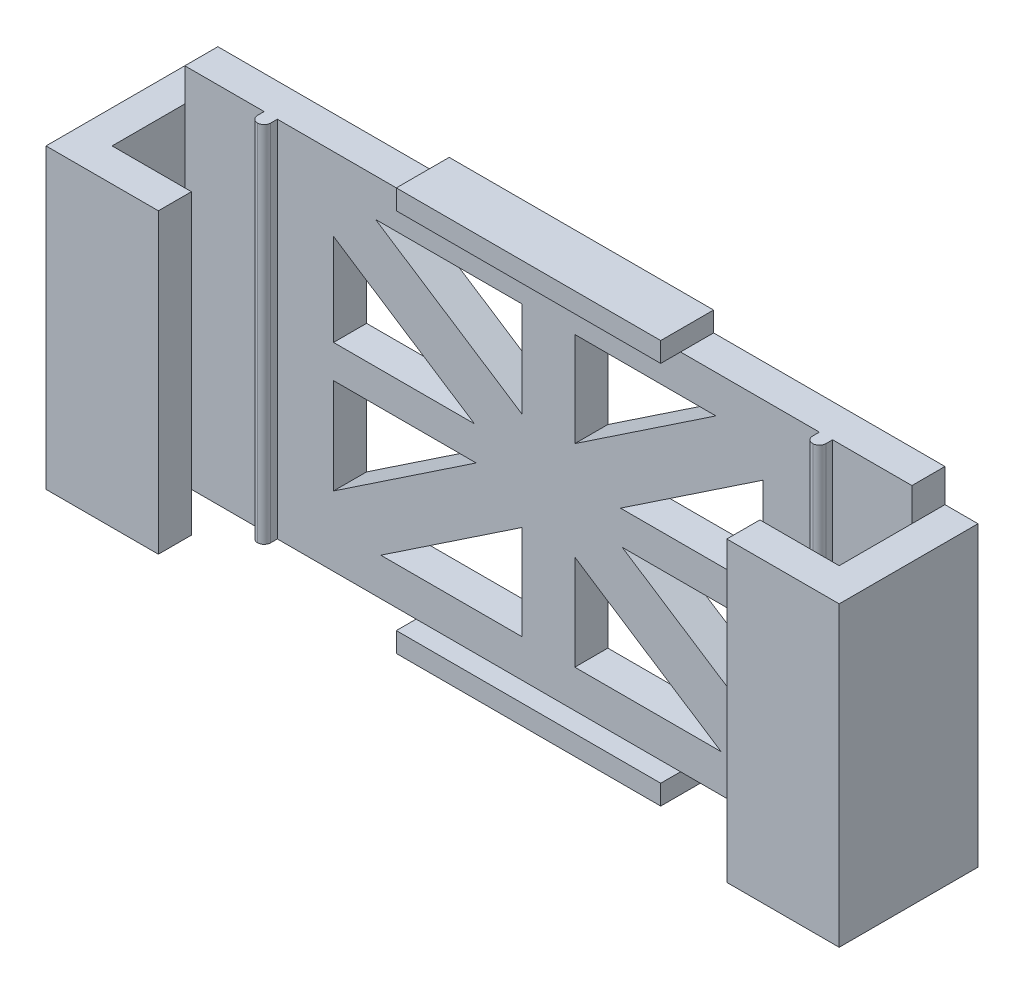
from build123d import *

# Parameters (mm, degrees)
SKETCH1_W             = 82
SKETCH1_H             = 55
BOSS_EXTRUDE1_DEPTH   = 5
SKETCH1_W_2           = 12
BOSS_EXTRUDE1_2_DEPTH = 5
BOSS_EXTRUDE1_3_DEPTH = 5
SKETCH1_3_W           = 2
SKETCH1_3_H           = 55
BOSS_EXTRUDE2_DEPTH   = 7
FILLET1_R             = 1
SKETCH2_W             = 5
SKETCH2_H             = 45
BOSS_EXTRUDE3_DEPTH   = 16
SKETCH3_W             = 17
SKETCH3_H             = 45
BOSS_EXTRUDE4_DEPTH   = 5
SKETCH4_W             = 40
SKETCH4_H             = 3
BOSS_EXTRUDE5_DEPTH   = 8
CUT_EXTRUDE1_DEPTH    = 8


with BuildPart() as part:
    # Sketch1 → Boss-Extrude1 (new body)
    with BuildSketch(Plane.XY):
        Rectangle(SKETCH1_W, SKETCH1_H)
    extrude(amount=BOSS_EXTRUDE1_DEPTH)



with BuildPart() as body_2:
    # Sketch1 → Boss-Extrude1 2 (new body)
    with BuildSketch(Plane.XY):
        with Locations((-49, 0)):
            Rectangle(SKETCH1_W_2, SKETCH1_H)
    extrude(amount=BOSS_EXTRUDE1_2_DEPTH)


with BuildPart() as body_3:
    # Sketch1 → Boss-Extrude1 3 (new body)
    with BuildSketch(Plane.XY):
        with Locations((49, 0)):
            Rectangle(SKETCH1_W_2, SKETCH1_H)
    extrude(amount=BOSS_EXTRUDE1_3_DEPTH)


with BuildPart() as part_1:
    add(part.part)

    add(body_2.part)  # Boss-Extrude2 merges body 2

    add(body_3.part)  # Boss-Extrude2 merges body 3
    # Sketch1<3> → Boss-Extrude2 (add)
    with BuildSketch(Plane.XY):
        with Locations((42, 0)):
            Rectangle(SKETCH1_3_W, SKETCH1_3_H)
        with Locations((-42, 0)):
            Rectangle(SKETCH1_3_W, SKETCH1_3_H)
    extrude(amount=BOSS_EXTRUDE2_DEPTH)

    # Fillet1
    fillet1_edges = [part_1.edges().sort_by_distance(p)[0] for p in [
        (-43, 0, 7),
        (-41, 0, 7),
        (41, 0, 7),
        (43, 0, 7),
    ]]
    fillet(fillet1_edges, radius=FILLET1_R - 0.0001)  # a hair under: the kernel refuses the full size

    # Sketch2 → Boss-Extrude3 (add)
    with BuildSketch(Plane.XY):
        with Locations((-57.5, 0)):
            Rectangle(SKETCH2_W, SKETCH2_H)
        with Locations((57.5, 0)):
            Rectangle(SKETCH2_W, SKETCH2_H)
    extrude(amount=BOSS_EXTRUDE3_DEPTH)

    # Sketch3 → Boss-Extrude4 (add)
    with BuildSketch(Plane.XY.offset(16)):
        with Locations((51.5, 0)):
            Rectangle(SKETCH3_W, SKETCH3_H)
        with Locations((-51.5, 0)):
            Rectangle(SKETCH3_W, SKETCH3_H)
    extrude(amount=BOSS_EXTRUDE4_DEPTH)

    # Sketch4 → Boss-Extrude5 (add)
    with BuildSketch(Plane.XY):
        with Locations((0, -29)):
            Rectangle(SKETCH4_W, SKETCH4_H)
        with Locations((0, 29)):
            Rectangle(SKETCH4_W, SKETCH4_H)
    extrude(amount=BOSS_EXTRUDE5_DEPTH)

    # Sketch5 → Cut-Extrude1 (cut)
    with BuildSketch(Plane.XY.offset(5)):
        Polygon((32.5, -2.5), (11.171238341, -2.5), (32.5, -16.386089579), align=None)
        Polygon((26.151212641, -21.798780488), (4, -7.377234224), (4, -21.798780488), align=None)
        Polygon((-4, -7.494684737), (-25.350036879, -21.798780488), (-4, -21.798780488), align=None)
        Polygon((-10.917888224, -2.5), (-32.5, -2.5), (-32.5, -16.959581269), align=None)
        Polygon((-11.171238341, 2.5), (-32.5, 16.386089579), (-32.5, 2.5), align=None)
        Polygon((-4, 21.798780488), (-26.151212641, 21.798780488), (-4, 7.377234224), align=None)
        Polygon((25.350035913, 21.798780488), (4, 21.798780488), (4, 7.494685385), align=None)
        Polygon((32.5, 2.5), (32.5, 16.959581917), (10.917887257, 2.5), align=None)
    extrude(amount=-CUT_EXTRUDE1_DEPTH, mode=Mode.SUBTRACT)


solid = part_1.part
